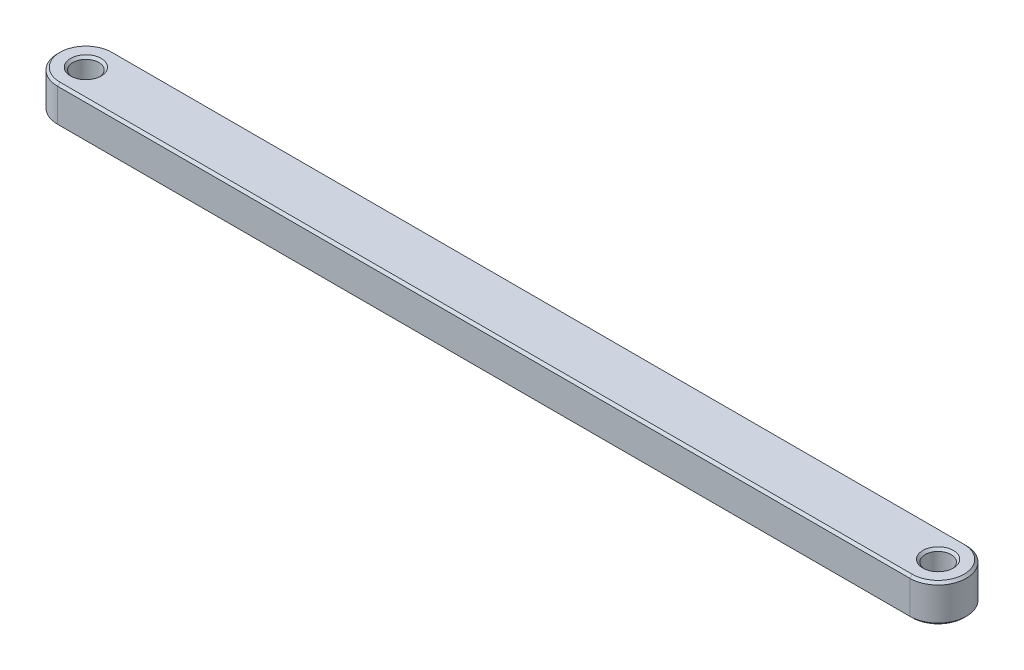
from build123d import *

# Parameters (mm, degrees)
SKETCH1_R           = 2.1828125
BOSS_EXTRUDE1_DEPTH = 6.35
CHAMFER1_SIZE       = 0.396875


with BuildPart() as part:
    # Sketch1 → Boss-Extrude1 (new body)
    with BuildSketch(Plane(origin=(0, 0, 0), x_dir=(1, 0, 0), z_dir=(0, 1, 0))):
        with BuildLine():
            Line((0, 4.7625), (143.684097937, 4.7625))
            ThreePointArc((143.684097937, 4.7625), (148.446597937, 0), (143.684097937, -4.7625))
            Line((143.684097937, -4.7625), (0, -4.7625))
            ThreePointArc((0, -4.7625), (-4.7625, 0), (0, 4.7625))
        make_face()
        Circle(SKETCH1_R, mode=Mode.SUBTRACT)
        with Locations((143.684097937, 0)):
            Circle(SKETCH1_R, mode=Mode.SUBTRACT)
    extrude(amount=BOSS_EXTRUDE1_DEPTH)

    # Chamfer1
    chamfer1_edges = [part.edges().sort_by_distance(p)[0] for p in [
        (141.501285437, 0, 0),
        (-2.1828125, 0, 0),
        (71.842048969, 0, 4.7625),
        (148.446597937, 0, 0),
        (71.842048969, 0, -4.7625),
        (-4.7625, 0, 0),
        (141.501285437, 6.35, 0),
        (71.842048969, 6.35, -4.7625),
        (148.446597937, 6.35, 0),
        (71.842048969, 6.35, 4.7625),
        (-4.7625, 6.35, 0),
        (-2.1828125, 6.35, 0),
    ]]
    chamfer(chamfer1_edges, length=CHAMFER1_SIZE)


solid = part.part
